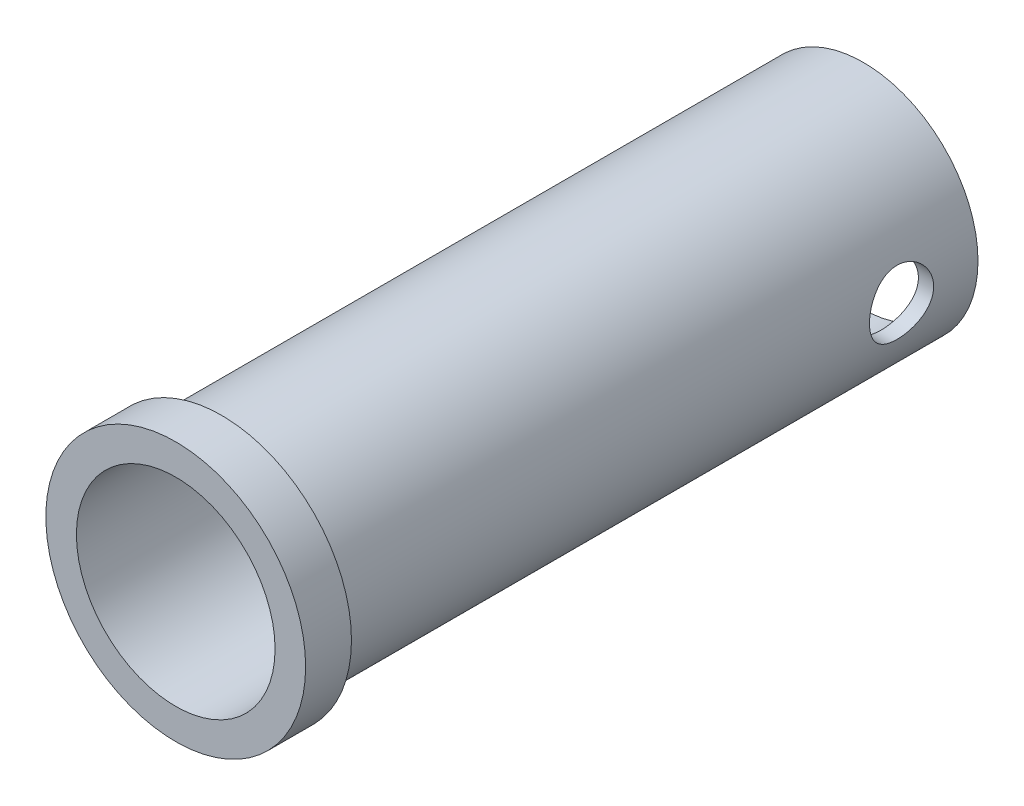
from build123d import *
from build123d.topology import SkipClean

# Parameters (mm, degrees)
ESBO_O1_R                  = 8.5
ESBO_O1_R_2                = 6.5
RESSALTO_EXTRUS_O1_DEPTH   = 3
RESSALTO_EXTRUS_O3_START   = 42
ESBO_O3_R                  = 7.5
ESBO_O3_R_2                = 6.5
RESSALTO_EXTRUS_O3_DEPTH   = 42
CORTE_EXTRUS_O1_DEPTH      = 44.686382318
CORTE_EXTRUS_O1_DEPTH_BACK = 44.686382318
ESBO_O4_R                  = 2.1


with BuildPart() as part:
    # Esboço1 → Ressalto-extrusão1 (new body)
    with BuildSketch(Plane.XY):
        Circle(ESBO_O1_R)
        Circle(ESBO_O1_R_2, mode=Mode.SUBTRACT)
    extrude(amount=RESSALTO_EXTRUS_O1_DEPTH)

    # Esboço3 → Ressalto-extrusão3 (add)
    with SkipClean():  # the faces are left unmerged after this step: merging them gives an invalid solid
        with BuildSketch(Plane(origin=(0, 0, 0), x_dir=(-1, 0, 0), z_dir=(0, 0, -1)).offset(RESSALTO_EXTRUS_O3_START)):
            Circle(ESBO_O3_R)
            Circle(ESBO_O3_R_2, mode=Mode.SUBTRACT)
        extrude(amount=-RESSALTO_EXTRUS_O3_DEPTH)

    # Esboço4 → Corte-extrusão1 (cut, two sides: drawn at the far end of the back side and taken through both)
    with SkipClean():  # the faces are left unmerged after this step: merging them gives an invalid solid
        with BuildSketch(Plane(origin=(0, 0, 0), x_dir=(0, 0, -1), z_dir=(1, 0, 0)).offset(-CORTE_EXTRUS_O1_DEPTH_BACK)):
            with Locations((37, 0)):
                Circle(ESBO_O4_R)
        extrude(amount=CORTE_EXTRUS_O1_DEPTH + CORTE_EXTRUS_O1_DEPTH_BACK, mode=Mode.SUBTRACT)


solid = part.part
